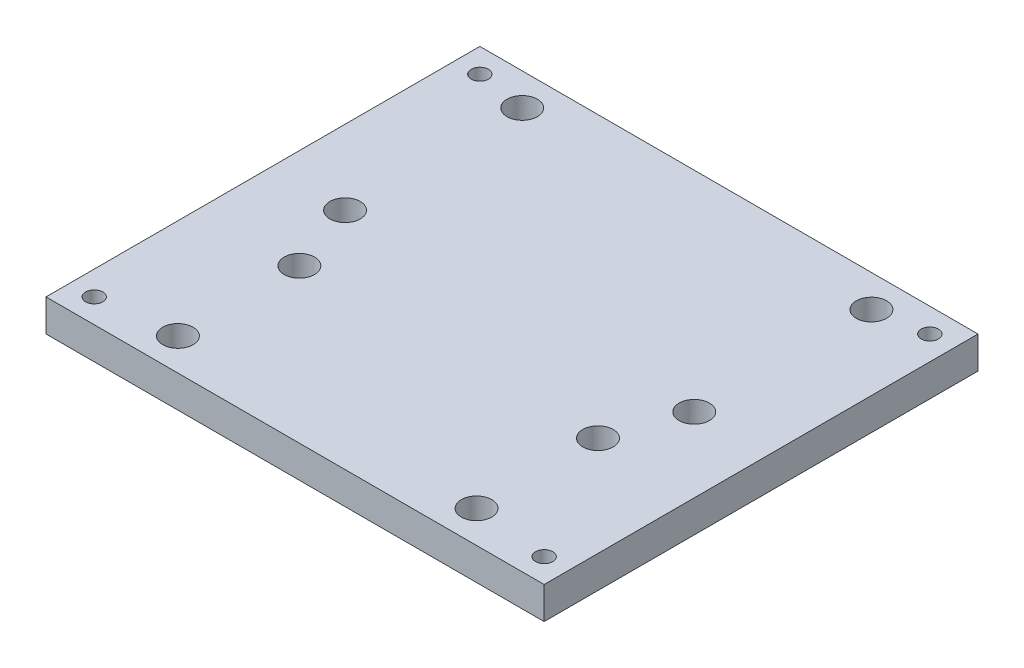
from build123d import *

# Parameters (mm, degrees)
SKETCH1_W            = 98.425
SKETCH1_H            = 85.725
BOSS_EXTRUDE1_DEPTH  = 6.35
M3_CLEARANCE_HOLE1_D = 3.4
SKETCH3_R            = 3
CUT_EXTRUDE1_DEPTH   = 66.569707659


with BuildPart() as part:
    # Sketch1 → Boss-Extrude1 (new body)
    with BuildSketch(Plane(origin=(0, 0, 0), x_dir=(1, 0, 0), z_dir=(0, 1, 0))):
        Rectangle(SKETCH1_W, SKETCH1_H)
    extrude(amount=BOSS_EXTRUDE1_DEPTH)

    # M3 Clearance Hole1 (through all)
    with Locations(Plane(origin=(-44.45, 0, 38.1), x_dir=(0, 0, -1), z_dir=(0, -1, 0))):
        with Locations((0, 0), (0, 88.9), (76.2, 0), (76.2, 88.9)):
            Hole(M3_CLEARANCE_HOLE1_D / 2)

    # Sketch3 → Cut-Extrude1 (cut, through all)
    with BuildSketch(Plane(origin=(0, 6.35, 0), x_dir=(1, 0, 0), z_dir=(0, 1, 0))):
        with Locations((-34.5, 36.5125)):
            Circle(SKETCH3_R)
        with Locations((34.5, 36.5125)):
            Circle(SKETCH3_R)
        with Locations((34.5, 1.5125)):
            Circle(SKETCH3_R)
        with Locations((-34.5, 1.5125)):
            Circle(SKETCH3_R)
        with Locations((-29.5, -12.5125)):
            Circle(SKETCH3_R)
        with Locations((-29.5, -36.5125)):
            Circle(SKETCH3_R)
        with Locations((29.5, -36.5125)):
            Circle(SKETCH3_R)
        with Locations((29.5, -12.5125)):
            Circle(SKETCH3_R)
    extrude(amount=-CUT_EXTRUDE1_DEPTH, mode=Mode.SUBTRACT)


solid = part.part
